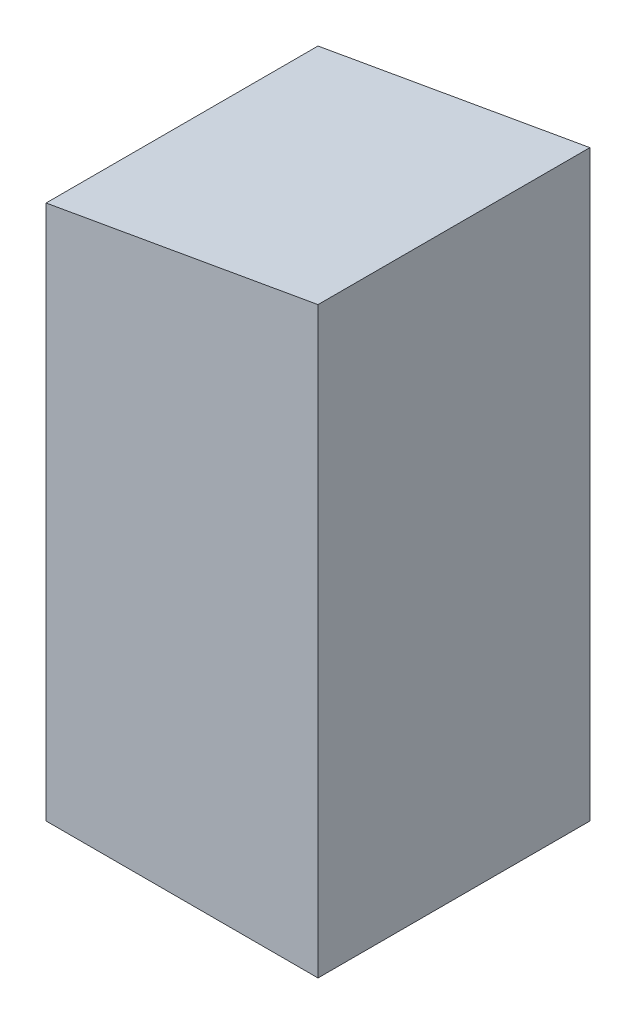
from build123d import *

# Parameters (mm, degrees)
BOSS_EXTRUDE1_DEPTH = 50.8


with BuildPart() as part:
    # Sketch2 → Boss-Extrude1 (new body)
    with BuildSketch(Plane.XY):
        Polygon((50.8, 108.95741062), (0, 100), (0, 0), (50.8, 0), align=None)
    extrude(amount=BOSS_EXTRUDE1_DEPTH)


solid = part.part
